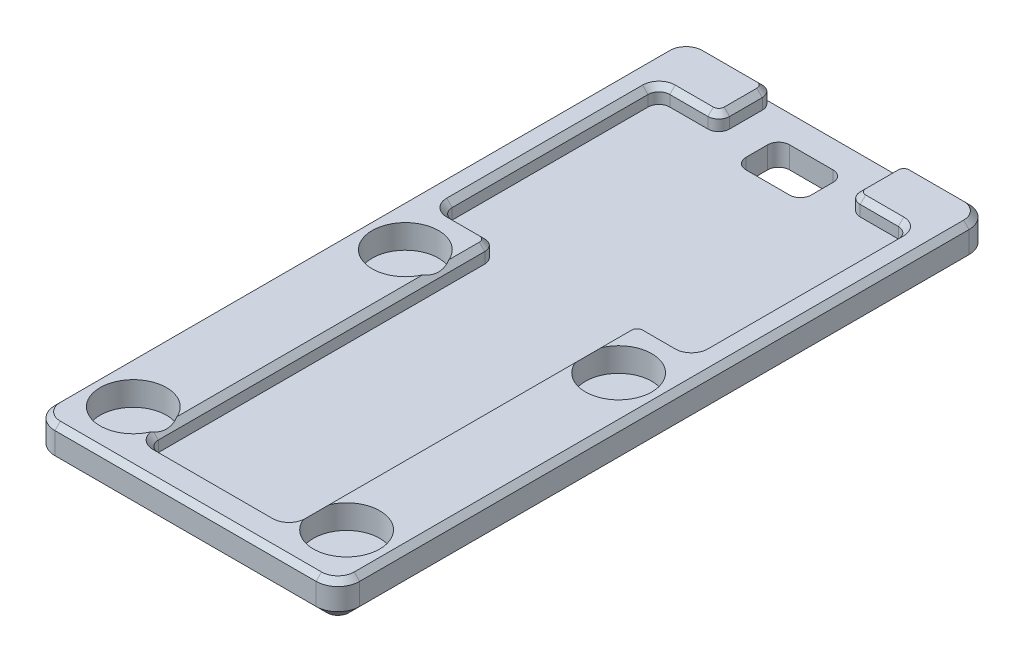
from build123d import *

# Parameters (mm, degrees)
SKETCH1_R           = 3.05
BOSS_EXTRUDE1_DEPTH = 3.5
SKETCH1_3_W         = 13
SKETCH1_3_H         = 32
SKETCH1_3_W_2       = 12
SKETCH1_3_H_2       = 5
BOSS_EXTRUDE2_DEPTH = 2
SKETCH1_4_R         = 3.05
BOSS_EXTRUDE3_DEPTH = 1.3
SKETCH2_W           = 6
SKETCH2_H           = 4
CUT_EXTRUDE1_DEPTH  = 4
FILLET1_R           = 1
FILLET2_R           = 1
FILLET3_R           = 1
FILLET4_R           = 2
CHAMFER1_SIZE       = 1
CHAMFER2_SIZE       = 0.5
CUT_EXTRUDE2_DEPTH  = 0.4


with BuildPart() as part:
    # Sketch1 → Boss-Extrude1 (new body)
    with BuildSketch(Plane(origin=(0, 0, 0), x_dir=(1, 0, 0), z_dir=(0, 1, 0))):
        Polygon((8, 0), (0, 0), (0, -60), (28, -60), (28, 0), (20, 0), (20, -5), (25.5, -5), (25.5, -25), (20.5, -25), (20.5, -57), (7.5, -57), (7.5, -25), (2.5, -25), (2.5, -5), (8, -5), align=None)
        with Locations(Location((4.2, -55, 0), (0, 0, 270))):
            Circle(SKETCH1_R, mode=Mode.SUBTRACT)
        with Locations(Location((4.2, -30, 0), (0, 0, 270))):
            Circle(SKETCH1_R, mode=Mode.SUBTRACT)
        with Locations(Location((23.8, -55, 0), (0, 0, 270))):
            Circle(SKETCH1_R, mode=Mode.SUBTRACT)
        with Locations(Location((23.8, -30, 0), (0, 0, 270))):
            Circle(SKETCH1_R, mode=Mode.SUBTRACT)
    extrude(amount=BOSS_EXTRUDE1_DEPTH)

    # Sketch1<3> → Boss-Extrude2 (add)
    with BuildSketch(Plane(origin=(0, 0, 0), x_dir=(1, 0, 0), z_dir=(0, 1, 0))):
        with Locations((14, -41)):
            Rectangle(SKETCH1_3_W, SKETCH1_3_H)
        Polygon((20, -5), (8, -5), (2.5, -5), (2.5, -25), (7.5, -25), (20.5, -25), (25.5, -25), (25.5, -5), align=None)
        with Locations((14, -2.5)):
            Rectangle(SKETCH1_3_W_2, SKETCH1_3_H_2)
    extrude(amount=BOSS_EXTRUDE2_DEPTH)

    # Sketch1<4> → Boss-Extrude3 (add)
    with BuildSketch(Plane(origin=(0, 0, 0), x_dir=(1, 0, 0), z_dir=(0, 1, 0))):
        with Locations(Location((4.2, -30, 0), (0, 0, 270))):
            Circle(SKETCH1_4_R)
        with Locations(Location((23.8, -30, 0), (0, 0, 270))):
            Circle(SKETCH1_4_R)
        with Locations(Location((4.2, -55, 0), (0, 0, 270))):
            Circle(SKETCH1_4_R)
        with Locations(Location((23.8, -55, 0), (0, 0, 270))):
            Circle(SKETCH1_4_R)
    extrude(amount=BOSS_EXTRUDE3_DEPTH)

    # Sketch2 → Cut-Extrude1 (cut)
    with BuildSketch(Plane(origin=(0, 2, 0), x_dir=(1, 0, 0), z_dir=(0, 1, 0))):
        with Locations((14, -4.5)):
            Rectangle(SKETCH2_W, SKETCH2_H)
    extrude(amount=-CUT_EXTRUDE1_DEPTH, mode=Mode.SUBTRACT)

    # Fillet1
    fillet1_edges = [part.edges().sort_by_distance(p)[0] for p in [
        (11, 1, 6.5),
        (11, 1, 2.5),
        (17, 1, 2.5),
        (17, 1, 6.5),
    ]]
    fillet(fillet1_edges, radius=FILLET1_R)

    # Fillet2
    fillet2_edges = [part.edges().sort_by_distance(p)[0] for p in [
        (25.5, 2.75, 25),
        (25.5, 2.75, 5),
        (20, 2.75, 5),
        (8, 2.75, 5),
        (2.5, 2.75, 5),
        (2.5, 2.75, 25),
        (7.5, 2.75, 25),
        (7.5, 2.75, 57),
        (20.5, 2.75, 57),
        (20.5, 2.75, 25),
    ]]
    fillet(fillet2_edges, radius=FILLET2_R)

    # Fillet3
    fillet3_edges = [part.edges().sort_by_distance(p)[0] for p in [
        (20, 2.75, 0),
        (8, 2.75, 0),
    ]]
    fillet(fillet3_edges, radius=FILLET3_R)

    # Fillet4
    fillet4_edges = [part.edges().sort_by_distance(p)[0] for p in [
        (28, 1.75, 0),
        (28, 1.75, 60),
        (0, 1.75, 60),
        (0, 1.75, 0),
    ]]
    fillet(fillet4_edges, radius=FILLET4_R)

    # Chamfer1
    chamfer1_edges = [part.edges().sort_by_distance(p)[0] for p in [
        (28, 0, 30),
        (0, 0, 30),
        (14, 0, 0),
        (14, 0, 60),
        (0.585786438, 0, 0.585786438),
        (27.414213562, 0, 0.585786438),
        (0.585786438, 0, 59.414213562),
        (27.414213562, 0, 59.414213562),
    ]]
    chamfer(chamfer1_edges, length=CHAMFER1_SIZE)

    # Chamfer2
    # the kernel refuses this chamfer: 0.5 mm, written as the material it takes off along each edge
    with BuildSketch(Plane(origin=(8.5, 3.5, 56), x_dir=(-1, 0, 0), z_dir=(0, 0, -1))) as chamfer2_piece_1:
        Polygon((1 + CHAMFER2_SIZE, 0), (1, -CHAMFER2_SIZE), (1, 0), align=None)
    revolve(axis=Axis((8.5, 3.5, 56), (0, 1, 0)), revolution_arc=90, mode=Mode.SUBTRACT)
    with BuildSketch(Plane(origin=(7.5, 3.5, 56), x_dir=(-0.9996219169112968, 0.02749587661058651, 0), z_dir=(0, 0, -1)), Plane(origin=(20.5, 3.5, 26), x_dir=(0.9996219169112968, 0.027495876610586414, 0), z_dir=(0, 0, 1))) as chamfer2_piece_2:
        Polygon((CHAMFER2_SIZE * 0.999621916911, -CHAMFER2_SIZE * 0.0274958766106), (-CHAMFER2_SIZE * 0.0274958766106, -CHAMFER2_SIZE * 0.999621916911), (0, 0), align=None)
    extrude(amount=30, mode=Mode.SUBTRACT)
    with BuildSketch(Plane(origin=(19.5, 3.5, 57), x_dir=(0, 0.027495876610586605, 0.9996219169112968), z_dir=(-1, 0, 0))) as chamfer2_piece_3:
        Polygon((CHAMFER2_SIZE * 0.999621916911, -CHAMFER2_SIZE * 0.0274958766106), (-CHAMFER2_SIZE * 0.0274958766106, -CHAMFER2_SIZE * 0.999621916911), (0, 0), align=None)
    extrude(amount=11, mode=Mode.SUBTRACT)
    with BuildSketch(Plane(origin=(6.5, 3.5, 26), x_dir=(0, 0, -1), z_dir=(-1, 0, 0))) as chamfer2_piece_4:
        Polygon((1 - CHAMFER2_SIZE, 0), (1, CHAMFER2_SIZE), (1, 0), align=None)
    revolve(axis=Axis((6.5, 3.5, 26), (0, -1, 0)), revolution_arc=90, mode=Mode.SUBTRACT)
    with BuildSketch(Plane(origin=(19.5, 3.5, 56), x_dir=(0, 0, 1), z_dir=(-1, 0, 0))) as chamfer2_piece_5:
        Polygon((1 + CHAMFER2_SIZE, 0), (1, -CHAMFER2_SIZE), (1, 0), align=None)
    revolve(axis=Axis((19.5, 3.5, 56), (0, 1, 0)), revolution_arc=90, mode=Mode.SUBTRACT)
    with BuildSketch(Plane(origin=(6.5, 3.5, 25), x_dir=(0, 0.027495876610586414, 0.9996219169112968), z_dir=(-1, 0, 0)), Plane(origin=(24.5, 3.5, 25), x_dir=(0, 0.027495876610586414, 0.9996219169112968), z_dir=(-1, 0, 0)), Plane(origin=(8, 3.5, 4), x_dir=(-0.9996219169112968, 0.02749587661058651, 0), z_dir=(0, 0, -1)), Plane(origin=(20, 3.5, 1), x_dir=(0.9996219169112968, 0.027495876610586414, 0), z_dir=(0, 0, 1))) as chamfer2_piece_6:
        Polygon((CHAMFER2_SIZE * 0.999621916911, -CHAMFER2_SIZE * 0.0274958766106), (-CHAMFER2_SIZE * 0.0274958766106, -CHAMFER2_SIZE * 0.999621916911), (0, 0), align=None)
    extrude(amount=3, mode=Mode.SUBTRACT)
    with BuildSketch(Plane(origin=(3.5, 3.5, 24), x_dir=(-1, 0, 0), z_dir=(0, 0, -1))) as chamfer2_piece_7:
        Polygon((1 + CHAMFER2_SIZE, 0), (1, -CHAMFER2_SIZE), (1, 0), align=None)
    revolve(axis=Axis((3.5, 3.5, 24), (0, 1, 0)), revolution_arc=90, mode=Mode.SUBTRACT)
    with BuildSketch(Plane(origin=(21.5, 3.5, 26), x_dir=(-1, 0, 0), z_dir=(0, 0, 1))) as chamfer2_piece_8:
        Polygon((1 - CHAMFER2_SIZE, 0), (1, CHAMFER2_SIZE), (1, 0), align=None)
    revolve(axis=Axis((21.5, 3.5, 26), (0, -1, 0)), revolution_arc=90, mode=Mode.SUBTRACT)
    with BuildSketch(Plane(origin=(2.5, 3.5, 24), x_dir=(-0.9996219169112968, 0.027495876610586438, 0), z_dir=(0, 0, -1)), Plane(origin=(25.5, 3.5, 6), x_dir=(0.9996219169112968, 0.027495876610586414, 0), z_dir=(0, 0, 1))) as chamfer2_piece_9:
        Polygon((CHAMFER2_SIZE * 0.999621916911, -CHAMFER2_SIZE * 0.0274958766106), (-CHAMFER2_SIZE * 0.0274958766106, -CHAMFER2_SIZE * 0.999621916911), (0, 0), align=None)
    extrude(amount=18, mode=Mode.SUBTRACT)
    with BuildSketch(Plane(origin=(3.5, 3.5, 6), x_dir=(0, 0, -1), z_dir=(1, 0, 0))) as chamfer2_piece_10:
        Polygon((1 + CHAMFER2_SIZE, 0), (1, -CHAMFER2_SIZE), (1, 0), align=None)
    revolve(axis=Axis((3.5, 3.5, 6), (0, 1, 0)), revolution_arc=90, mode=Mode.SUBTRACT)
    with BuildSketch(Plane(origin=(24.5, 3.5, 24), x_dir=(1, 0, 0), z_dir=(0, 0, -1))) as chamfer2_piece_11:
        Polygon((1 + CHAMFER2_SIZE, 0), (1, CHAMFER2_SIZE), (1, 0), align=None)
    revolve(axis=Axis((24.5, 3.5, 24), (0, -1, 0)), revolution_arc=90, mode=Mode.SUBTRACT)
    with BuildSketch(Plane(origin=(3.5, 3.5, 5), x_dir=(0, 0.02749587661058651, -0.9996219169112968), z_dir=(1, 0, 0)), Plane(origin=(21, 3.5, 5), x_dir=(0, 0.027495876610586414, -0.9996219169112968), z_dir=(1, 0, 0))) as chamfer2_piece_12:
        Polygon((CHAMFER2_SIZE * 0.999621916911, -CHAMFER2_SIZE * 0.0274958766106), (-CHAMFER2_SIZE * 0.0274958766106, -CHAMFER2_SIZE * 0.999621916911), (0, 0), align=None)
    extrude(amount=3.5, mode=Mode.SUBTRACT)
    with BuildSketch(Plane(origin=(7, 3.5, 4), x_dir=(0, 0, 1), z_dir=(-1, 0, 0))) as chamfer2_piece_13:
        Polygon((1 - CHAMFER2_SIZE, 0), (1, -CHAMFER2_SIZE), (1, 0), align=None)
    revolve(axis=Axis((7, 3.5, 4), (0, 1, 0)), revolution_arc=90, mode=Mode.SUBTRACT)
    with BuildSketch(Plane(origin=(24.5, 3.5, 6), x_dir=(0, 0, -1), z_dir=(-1, 0, 0))) as chamfer2_piece_14:
        Polygon((1 + CHAMFER2_SIZE, 0), (1, CHAMFER2_SIZE), (1, 0), align=None)
    revolve(axis=Axis((24.5, 3.5, 6), (0, -1, 0)), revolution_arc=90, mode=Mode.SUBTRACT)
    with BuildSketch(Plane(origin=(7, 3.5, 1), x_dir=(1, 0, 0), z_dir=(0, 0, 1))) as chamfer2_piece_15:
        Polygon((1 - CHAMFER2_SIZE, 0), (1, -CHAMFER2_SIZE), (1, 0), align=None)
    revolve(axis=Axis((7, 3.5, 1), (0, 1, 0)), revolution_arc=90, mode=Mode.SUBTRACT)
    with BuildSketch(Plane(origin=(21, 3.5, 4), x_dir=(-1, 0, 0), z_dir=(0, 0, -1))) as chamfer2_piece_16:
        Polygon((1 - CHAMFER2_SIZE, 0), (1, -CHAMFER2_SIZE), (1, 0), align=None)
    revolve(axis=Axis((21, 3.5, 4), (0, 1, 0)), revolution_arc=90, mode=Mode.SUBTRACT)
    with BuildSketch(Plane(origin=(7, 3.5, 0), x_dir=(0, -0.9996219169112968, -0.027495876610586365), z_dir=(-1, 0, 0)), Plane(origin=(26, 3.5, 0), x_dir=(0, -0.9996219169112968, -0.027495876610586365), z_dir=(-1, 0, 0))) as chamfer2_piece_17:
        Polygon((CHAMFER2_SIZE * 0.999621916911, CHAMFER2_SIZE * 0.0274958766106), (-CHAMFER2_SIZE * 0.0274958766106, CHAMFER2_SIZE * 0.999621916911), (0, 0), align=None)
    extrude(amount=5, mode=Mode.SUBTRACT)
    with BuildSketch(Plane(origin=(2, 3.5, 2), x_dir=(-1, 0, 0), z_dir=(0, 0, 1))) as chamfer2_piece_18:
        Polygon((2, CHAMFER2_SIZE), (2 - CHAMFER2_SIZE, 0), (2, 0), align=None)
    revolve(axis=Axis((2, 3.5, 2), (0, -1, 0)), revolution_arc=90, mode=Mode.SUBTRACT)
    with BuildSketch(Plane(origin=(21, 3.5, 1), x_dir=(0, 0, -1), z_dir=(1, 0, 0))) as chamfer2_piece_19:
        Polygon((1 - CHAMFER2_SIZE, 0), (1, -CHAMFER2_SIZE), (1, 0), align=None)
    revolve(axis=Axis((21, 3.5, 1), (0, 1, 0)), revolution_arc=90, mode=Mode.SUBTRACT)
    with BuildSketch(Plane(origin=(0, 3.5, 2), x_dir=(-0.02749587661058636, -0.9996219169112968, 0), z_dir=(0, 0, 1)), Plane(origin=(28, 3.5, 58), x_dir=(0.02749587661058907, -0.9996219169112965, 0), z_dir=(0, 0, -1))) as chamfer2_piece_20:
        Polygon((CHAMFER2_SIZE * 0.999621916911, CHAMFER2_SIZE * 0.0274958766106), (-CHAMFER2_SIZE * 0.0274958766106, CHAMFER2_SIZE * 0.999621916911), (0, 0), align=None)
    extrude(amount=56, mode=Mode.SUBTRACT)
    with BuildSketch(Plane(origin=(2, 3.5, 58), x_dir=(0, 0, 1), z_dir=(1, 0, 0))) as chamfer2_piece_21:
        Polygon((2, CHAMFER2_SIZE), (2 - CHAMFER2_SIZE, 0), (2, 0), align=None)
    revolve(axis=Axis((2, 3.5, 58), (0, -1, 0)), revolution_arc=90, mode=Mode.SUBTRACT)
    with BuildSketch(Plane(origin=(26, 3.5, 2), x_dir=(1, 0, 0), z_dir=(0, 0, 1))) as chamfer2_piece_22:
        Polygon((2, -CHAMFER2_SIZE), (2 - CHAMFER2_SIZE, 0), (2, 0), align=None)
    revolve(axis=Axis((26, 3.5, 2), (0, 1, 0)), revolution_arc=90, mode=Mode.SUBTRACT)
    with BuildSketch(Plane(origin=(2, 3.5, 60), x_dir=(0, -0.999621916911297, 0.027495876610582174), z_dir=(1, 0, 0))) as chamfer2_piece_23:
        Polygon((CHAMFER2_SIZE * 0.999621916911, CHAMFER2_SIZE * 0.0274958766106), (-CHAMFER2_SIZE * 0.0274958766106, CHAMFER2_SIZE * 0.999621916911), (0, 0), align=None)
    extrude(amount=24, mode=Mode.SUBTRACT)
    with BuildSketch(Plane(origin=(26, 3.5, 58), x_dir=(1, 0, 0), z_dir=(0, 0, -1))) as chamfer2_piece_24:
        Polygon((2, CHAMFER2_SIZE), (2 - CHAMFER2_SIZE, 0), (2, 0), align=None)
    revolve(axis=Axis((26, 3.5, 58), (0, -1, 0)), revolution_arc=90, mode=Mode.SUBTRACT)

    # Sketch3 → Cut-Extrude2 (cut)
    with BuildSketch(Plane.XZ):
        with BuildLine():
            add(Edge.make_bspline(
                [(14.097910653, 12.243532923), (20.639688273, 22.096806587), (22.846088229, 32.130025027), (23.610210653, 42.464770423)],
                knots=[0, 0, 0, 0, 1, 1, 1, 1], degree=3))
            add(Edge.make_bspline(
                [(23.610210653, 42.464770423), (19.368087057, 37.051812999), (15.634224065, 33.503649915), (12.891410653, 31.855507923)],
                knots=[0, 0, 0, 0, 1, 1, 1, 1], degree=3))
            add(Edge.make_bspline(
                [(12.891410653, 31.855507923), (9.863152041, 30.035843795), (7.255065309, 32.914045303), (4.691973153, 40.020020423)],
                knots=[0, 0, 0, 0, 1, 1, 1, 1], degree=3))
            add(Edge.make_bspline(
                [(4.691973153, 40.020020423), (6.392651997, 30.746919843), (7.568627293, 21.672393415), (14.097910653, 12.243532923)],
                knots=[0, 0, 0, 0, 1, 1, 1, 1], degree=3))
        make_face()
        Polygon((14.045523153, 15.977332923), (13.094610653, 23.749732923), (10.805435653, 24.529195423), (12.886648153, 25.634095423), (12.612010653, 28.113770423), (14.020123153, 25.711882923), (15.502848153, 28.204257923), (15.202810653, 25.594407923), (17.320535653, 24.527607923), (15.021835653, 23.765607923), align=None, mode=Mode.SUBTRACT)
    extrude(amount=-CUT_EXTRUDE2_DEPTH, mode=Mode.SUBTRACT)


solid = part.part
